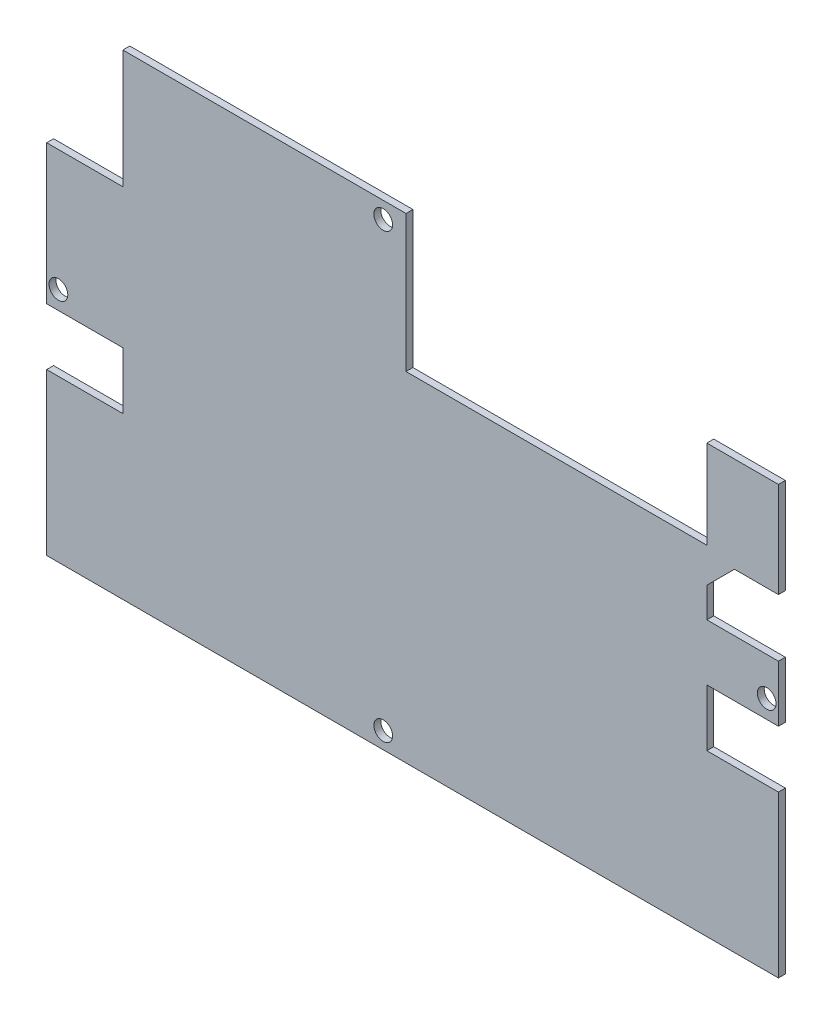
from build123d import *

# Parameters (mm, degrees)
BOSS_EXTRUDE1_DEPTH   = 1.5875
F_6_CLEARANCE_HOLE1_D = 4.3053


with BuildPart() as part:
    # Sketch1 → Boss-Extrude1 (new body)
    with BuildSketch(Plane.XY):
        Polygon((-41.367, 14.097), (6.663436815, 14.097), (23.618, 14.097), (23.618, -17.32), (92.658, -17.32), (92.658, 2.9845), (109.09675, 2.9845), (109.09675, -18.923), (99.008, -18.923), (92.658, -25.273), (92.658, -32.150898303), (109.09675, -32.150898303), (109.09675, -45.0855), (92.658, -45.0855), (92.658, -58.1655), (109.09675, -58.1655), (109.09675, -95.123), (90.082920323, -95.123), (9.878, -95.123), (-38.028966768, -95.123), (-58.86075, -95.123), (-58.86075, -58.1655), (-41.367, -58.1655), (-41.367, -45.0855), (-58.86075, -45.0855), (-58.86075, -13.0805), (-41.367, -13.0805), align=None)
    extrude(amount=BOSS_EXTRUDE1_DEPTH)

    # #6 Clearance Hole1 (through all)
    with Locations(Plane(origin=(0, 0, 0), x_dir=(-1, 0, 0), z_dir=(0, 0, -1))):
        with Locations((-106.398, -40.894), (-18.387, 10.287), (56.162, -40.894), (-18.387, -91.313)):
            Hole(F_6_CLEARANCE_HOLE1_D / 2)


solid = part.part
